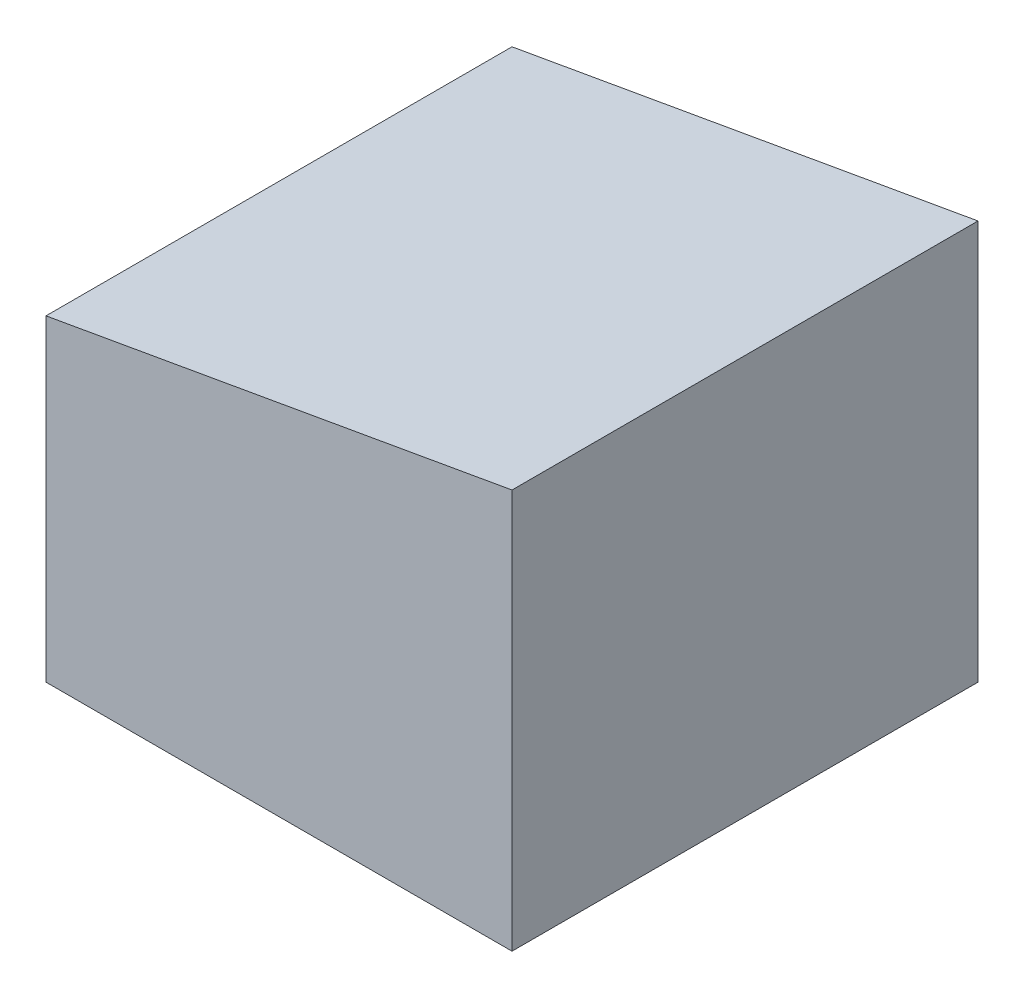
from build123d import *

# Parameters (mm, degrees)
SKETCH1_W           = 88.9
SKETCH1_H           = 88.9
BOSS_EXTRUDE1_DEPTH = 76.2
CUT_EXTRUDE1_DEPTH  = 135


with BuildPart() as part:
    # Sketch1 → Boss-Extrude1 (new body)
    with BuildSketch(Plane(origin=(0, 0, 0), x_dir=(1, 0, 0), z_dir=(0, 1, 0))):
        Rectangle(SKETCH1_W, SKETCH1_H)
    extrude(amount=BOSS_EXTRUDE1_DEPTH)

    # Sketch2 → Cut-Extrude1 (cut)
    with BuildSketch(Plane.XY.offset(44.45)):
        Polygon((44.45, 76.2), (-44.45, 60.524531415), (-44.45, 76.2), align=None)
    extrude(amount=-CUT_EXTRUDE1_DEPTH, mode=Mode.SUBTRACT)


solid = part.part
